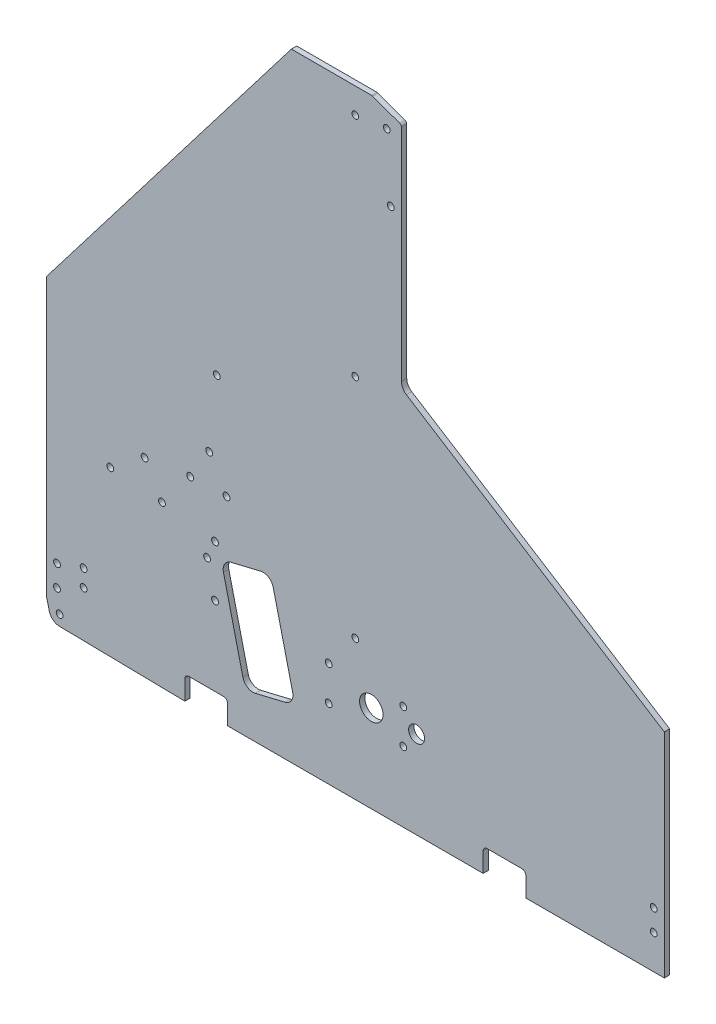
from build123d import *

# Parameters (mm, degrees)
SKETCH1_R           = 2.032
SKETCH1_R_2         = 2
BOSS_EXTRUDE1_DEPTH = 3.175
FILLET1_R           = 2.286
FILLET2_R           = 6.35
SKETCH2_R           = 2.032
CUT_EXTRUDE1_DEPTH  = 507.700158896
FILLET3_R           = 1.5875
CUT_EXTRUDE2_DEPTH  = 507.700158896
SKETCH4_R           = 2.032
SKETCH4_R_2         = 6.985
SKETCH4_R_3         = 4.7625
CUT_EXTRUDE3_DEPTH  = 507.700158896


with BuildPart() as part:
    # Sketch1 → Boss-Extrude1 (new body)
    with BuildSketch(Plane.XY):
        with BuildLine():
            Line((7.829508682, -19.049081656), (82.55, -20.32))
            Line((82.55, -20.32), (82.55, -6.35))
            Line((82.55, -6.35), (107.95, -6.35))
            Line((107.95, -6.35), (107.95, -20.32))
            Line((107.95, -20.32), (260.35, -20.32))
            Line((260.35, -20.32), (260.35, -6.35))
            Line((260.35, -6.35), (285.75, -6.35))
            Line((285.75, -6.35), (285.75, -20.32))
            Line((285.75, -20.32), (368.3, -20.32))
            Line((368.3, -20.32), (368.3, 106.68))
            Line((368.3, 106.68), (211.61375, 205.74))
            Line((211.61375, 205.74), (211.61375, 341.63))
            Line((211.61375, 341.63), (194.14998, 347.98))
            Line((194.14998, 347.98), (184.15, 347.98))
            Line((184.15, 347.98), (146.05, 347.98))
            Line((146.05, 347.98), (0, 157.48))
            Line((0, 157.48), (0, 0))
            Line((0, 0), (0, -6.35))
            ThreePointArc((0, -6.35), (0.047577015, -7.125863724), (0.189595124, -7.890101219))
            Line((0.189595124, -7.890101219), (1.777095124, -14.240101219))
            ThreePointArc((1.777095124, -14.240101219), (3.987212552, -17.671692778), (7.829508682, -19.049081656))
        make_face()
        with Locations((7.9375, -12.7)):
            Circle(SKETCH1_R, mode=Mode.SUBTRACT)
        with Locations((6.35, 0)):
            Circle(SKETCH1_R, mode=Mode.SUBTRACT)
        with Locations((6.35, 12.7)):
            Circle(SKETCH1_R, mode=Mode.SUBTRACT)
        with Locations((95.797306087, 60.410494967)):
            Circle(SKETCH1_R, mode=Mode.SUBTRACT)
        with Locations((184.15, 62.98)):
            Circle(SKETCH1_R_2, mode=Mode.SUBTRACT)
        with Locations((38.1, 78.105)):
            Circle(SKETCH1_R, mode=Mode.SUBTRACT)
        with Locations((68.887329744, 75.518700365)):
            Circle(SKETCH1_R, mode=Mode.SUBTRACT)
        with Locations((58.568579744, 93.391299635)):
            Circle(SKETCH1_R, mode=Mode.SUBTRACT)
        with Locations((85.725, 97.155)):
            Circle(SKETCH1_R, mode=Mode.SUBTRACT)
        with Locations((107.382158942, 97.743700365)):
            Circle(SKETCH1_R, mode=Mode.SUBTRACT)
        with Locations((97.063408942, 115.616299635)):
            Circle(SKETCH1_R, mode=Mode.SUBTRACT)
        with Locations((101.6, 157.48)):
            Circle(SKETCH1_R, mode=Mode.SUBTRACT)
        with Locations((361.95, 0)):
            Circle(SKETCH1_R, mode=Mode.SUBTRACT)
        with Locations((361.95, 12.7)):
            Circle(SKETCH1_R, mode=Mode.SUBTRACT)
        with Locations((184.15, 197.98)):
            Circle(SKETCH1_R_2, mode=Mode.SUBTRACT)
        with Locations((184.15, 332.98)):
            Circle(SKETCH1_R_2, mode=Mode.SUBTRACT)
        with Locations((205.26375, 296.418)):
            Circle(SKETCH1_R, mode=Mode.SUBTRACT)
        with Locations((202.881865, 335.28)):
            Circle(SKETCH1_R_2, mode=Mode.SUBTRACT)
    extrude(amount=BOSS_EXTRUDE1_DEPTH)

    # Fillet1
    fillet1_edges = [part.edges().sort_by_distance(p)[0] for p in [
        (285.75, -6.35, 1.5875),
        (107.95, -6.35, 1.5875),
        (260.35, -6.35, 1.5875),
        (82.55, -6.35, 1.5875),
    ]]
    fillet(fillet1_edges, radius=FILLET1_R)

    # Fillet2
    fillet2_edges = [part.edges().sort_by_distance(p)[0] for p in [
        (211.61375, 205.74, 1.5875),
    ]]
    fillet(fillet2_edges, radius=FILLET2_R)

    # Sketch2 → Cut-Extrude1 (cut, through all)
    with BuildSketch(Plane(origin=(0, 0, 0), x_dir=(-1, 0, 0), z_dir=(0, 0, -1))):
        with Locations((-100.552770272, 71.086035298)):
            Circle(SKETCH2_R)
        with Locations((-100.552770272, 40.606035298)):
            Circle(SKETCH2_R)
        with Locations((-22.225, 18.202541089)):
            Circle(SKETCH2_R)
        with Locations((-22.225, 8.042541089)):
            Circle(SKETCH2_R)
    extrude(amount=-CUT_EXTRUDE1_DEPTH, mode=Mode.SUBTRACT)

    # Fillet3
    fillet3_edges = [part.edges().sort_by_distance(p)[0] for p in [
        (211.61375, 341.63, 1.5875),
        (194.14998, 347.98, 1.5875),
    ]]
    fillet(fillet3_edges, radius=FILLET3_R)

    # Sketch3 → Cut-Extrude2 (cut, through all)
    with BuildSketch(Plane.XY.offset(3.175)):
        with BuildLine():
            Line((127.789350211, 69.359774106), (110.090750339, 65.117184968))
            ThreePointArc((110.090750339, 65.117184968), (106.287939856, 62.356288953), (105.55119507, 57.715047577))
            Line((105.55119507, 57.715047577), (117.160037875, 9.287010566))
            ThreePointArc((117.160037875, 9.287010566), (119.92093389, 5.484200083), (124.562175266, 4.747455297))
            Line((124.562175266, 4.747455297), (142.260775137, 8.990044434))
            ThreePointArc((142.260775137, 8.990044434), (146.063585621, 11.75094045), (146.800330407, 16.392181825))
            Line((146.800330407, 16.392181825), (135.191487602, 64.820218836))
            ThreePointArc((135.191487602, 64.820218836), (132.430591586, 68.62302932), (127.789350211, 69.359774106))
        make_face()
    extrude(amount=-CUT_EXTRUDE2_DEPTH, mode=Mode.SUBTRACT)

    # Sketch4 → Cut-Extrude3 (cut, through all)
    with BuildSketch(Plane.XY.offset(3.175)):
        with Locations((168.275, 42.06875)):
            Circle(SKETCH4_R)
        with Locations((212.725, 42.06875)):
            Circle(SKETCH4_R)
        with Locations((212.725, 21.43125)):
            Circle(SKETCH4_R)
        with Locations((168.275, 21.43125)):
            Circle(SKETCH4_R)
        with Locations((193.675, 31.75)):
            Circle(SKETCH4_R_2)
        with Locations((220.6625, 31.75)):
            Circle(SKETCH4_R_3)
    extrude(amount=-CUT_EXTRUDE3_DEPTH, mode=Mode.SUBTRACT)


solid = part.part
